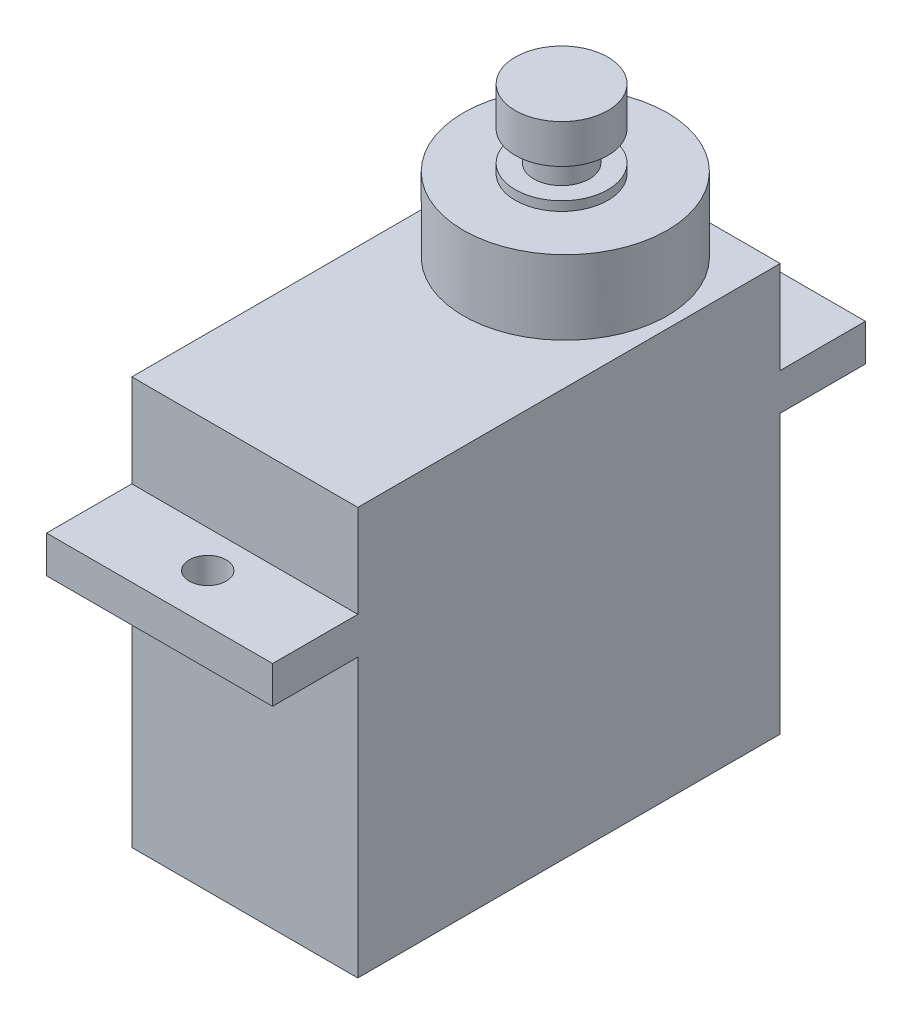
from build123d import *

# Parameters (mm, degrees)
SKETCH2_W           = 12.2
SKETCH2_H           = 22.8
BOSS_EXTRUDE1_DEPTH = 22
SKETCH3_W           = 12.2
SKETCH3_H           = 4.6
SKETCH3_R           = 1
BOSS_EXTRUDE2_DEPTH = 2
SKETCH4_R           = 5.5
BOSS_EXTRUDE3_DEPTH = 4
SKETCH5_R           = 2.5
BOSS_EXTRUDE4_DEPTH = 4.2
SKETCH6_W           = 1
SKETCH6_H           = 1.6


with BuildPart() as part:
    # Sketch2 → Boss-Extrude1 (new body)
    with BuildSketch(Plane(origin=(0, 0, 0), x_dir=(1, 0, 0), z_dir=(0, 1, 0))):
        Rectangle(SKETCH2_W, SKETCH2_H)
    extrude(amount=BOSS_EXTRUDE1_DEPTH)

    # Sketch3 → Boss-Extrude2 (add)
    # profile 1 of 2: a face of its own
    with BuildSketch(Plane(origin=(0, 15, 0), x_dir=(1, 0, 0), z_dir=(0, 1, 0))):
        with Locations((0, 13.7)):
            Rectangle(SKETCH3_W, SKETCH3_H)
        with Locations((0, 13.4)):
            Circle(SKETCH3_R, mode=Mode.SUBTRACT)
    # profile 2 of 2: a face of its own
    with BuildSketch(Plane(origin=(0, 15, 0), x_dir=(1, 0, 0), z_dir=(0, 1, 0))):
        with Locations((0, -13.7)):
            Rectangle(SKETCH3_W, SKETCH3_H)
        with Locations((0, -13.4)):
            Circle(SKETCH3_R, mode=Mode.SUBTRACT)
    extrude(amount=BOSS_EXTRUDE2_DEPTH)

    # Sketch4 → Boss-Extrude3 (add)
    with BuildSketch(Plane(origin=(0, 22, 0), x_dir=(1, 0, 0), z_dir=(0, 1, 0))):
        with Locations((0, 5.9)):
            Circle(SKETCH4_R)
    extrude(amount=BOSS_EXTRUDE3_DEPTH)

    # Sketch5 → Boss-Extrude4 (add)
    with BuildSketch(Plane(origin=(0, 26, 0), x_dir=(1, 0, 0), z_dir=(0, 1, 0))):
        with Locations((0, 5.7)):
            Circle(SKETCH5_R)
    extrude(amount=BOSS_EXTRUDE4_DEPTH)

    # Sketch6 → Cut-Revolve1 (revolve, cut)
    with BuildSketch(Plane(origin=(0, 0, 0), x_dir=(0, 0, -1), z_dir=(1, 0, 0))):
        with Locations((7.7, 27.3)):
            Rectangle(SKETCH6_W, SKETCH6_H)
    revolve(axis=Axis((0, 30.2, -5.7), (0, -1, 0)), mode=Mode.SUBTRACT)


solid = part.part
